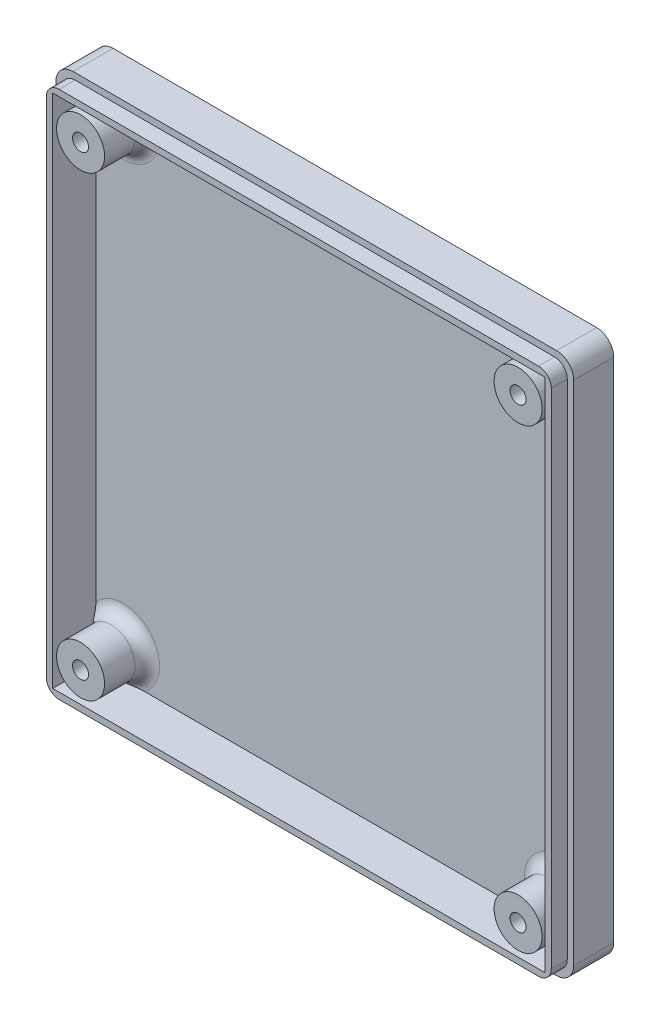
from build123d import *

# Parameters (mm, degrees)
EXTRUDE_THIN1_OUTLINE_W     = 97
EXTRUDE_THIN1_OUTLINE_H     = 101.4
EXTRUDE_THIN1_DEPTH         = 2.4
EXTRUDE_THIN1_START         = 8.1
EXTRUDE_THIN1_2_OUTLINE_W   = 97
EXTRUDE_THIN1_2_OUTLINE_H   = 101.4
EXTRUDE_THIN1_2_DEPTH       = 2.4
EXTRUDE_THIN1_START_2       = 2.4
EXTRUDE_THIN1_3_OUTLINE_W   = 97
EXTRUDE_THIN1_3_OUTLINE_H   = 101.4
EXTRUDE_THIN1_3_OUTLINE_W_2 = 92.2
EXTRUDE_THIN1_3_OUTLINE_H_2 = 96.6
EXTRUDE_THIN1_3_DEPTH       = 5.7
SKETCH4_W                   = 92.2
SKETCH4_H                   = 96.6
CUT_EXTRUDE2_DEPTH          = 2.4
SKETCH5_R                   = 4.5
BOSS_EXTRUDE1_DEPTH         = 8
SKETCH7_R                   = 1.5
CUT_EXTRUDE3_DEPTH          = 13.4
SKETCH10_R                  = 3
CUT_EXTRUDE4_DEPTH          = 3
SKETCH11_R                  = 3
CUT_EXTRUDE5_DEPTH          = 0.8
SKETCH12_W                  = 97
SKETCH12_H                  = 101.4
SKETCH12_W_2                = 94.6
SKETCH12_H_2                = 99
CUT_EXTRUDE_THIN2_DEPTH     = 3
FILLET2_R                   = 3.2
FILLET3_R                   = 2.4
FILLET4_R                   = 2.3


# Read off the part's stored shape, not the designer's step: Extrude-Thin1
with BuildPart() as part:
    # Extrude-Thin1 outline → Extrude-Thin1 (new body)
    with BuildSketch(Plane.XY):
        Rectangle(EXTRUDE_THIN1_OUTLINE_W, EXTRUDE_THIN1_OUTLINE_H)
    extrude(amount=EXTRUDE_THIN1_DEPTH)



with BuildPart() as body_2:
    # Extrude-Thin1 2 outline → Extrude-Thin1 2 (new body)
    with BuildSketch(Plane.XY.offset(EXTRUDE_THIN1_START)):
        Rectangle(EXTRUDE_THIN1_2_OUTLINE_W, EXTRUDE_THIN1_2_OUTLINE_H)
    extrude(amount=EXTRUDE_THIN1_2_DEPTH)


with BuildPart() as part_1:
    add(part.part)

    add(body_2.part)  # Extrude-Thin1 3 merges body 2
    # Extrude-Thin1 3 outline → Extrude-Thin1 3 (add)
    with BuildSketch(Plane.XY.offset(EXTRUDE_THIN1_START_2)):
        Rectangle(EXTRUDE_THIN1_3_OUTLINE_W, EXTRUDE_THIN1_3_OUTLINE_H)
        Rectangle(EXTRUDE_THIN1_3_OUTLINE_W_2, EXTRUDE_THIN1_3_OUTLINE_H_2, mode=Mode.SUBTRACT)
    extrude(amount=EXTRUDE_THIN1_3_DEPTH)

    # Sketch4 → Cut-Extrude2 (cut)
    with BuildSketch(Plane.XY.offset(10.5)):
        Rectangle(SKETCH4_W, SKETCH4_H)
    extrude(amount=-CUT_EXTRUDE2_DEPTH, mode=Mode.SUBTRACT)

    # Sketch5 → Boss-Extrude1 (add)
    with BuildSketch(Plane.XY.offset(2.4)):
        with Locations((-40.98, 42.8)):
            Circle(SKETCH5_R)
        with Locations((40.98, 42.8)):
            Circle(SKETCH5_R)
        with Locations((40.98, -42.8)):
            Circle(SKETCH5_R)
        with Locations((-40.98, -42.8)):
            Circle(SKETCH5_R)
    extrude(amount=BOSS_EXTRUDE1_DEPTH)

    # Sketch7 → Cut-Extrude3 (cut)
    with BuildSketch(Plane.XY.offset(10.4)):
        with Locations((-40.98, 42.8)):
            Circle(SKETCH7_R)
        with Locations((40.98, 42.8)):
            Circle(SKETCH7_R)
        with Locations((40.98, -42.8)):
            Circle(SKETCH7_R)
        with Locations((-40.98, -42.8)):
            Circle(SKETCH7_R)
    extrude(amount=-CUT_EXTRUDE3_DEPTH, mode=Mode.SUBTRACT)

    # Sketch10 → Cut-Extrude4 (cut)
    with BuildSketch(Plane(origin=(0, 0, 0), x_dir=(-1, 0, 0), z_dir=(0, 0, -1))):
        with Locations((-40.98, 42.8)):
            Circle(SKETCH10_R)
        with Locations((40.98, 42.8)):
            Circle(SKETCH10_R)
        with Locations((40.98, -42.8)):
            Circle(SKETCH10_R)
        with Locations((-40.98, -42.8)):
            Circle(SKETCH10_R)
    extrude(amount=-CUT_EXTRUDE4_DEPTH, mode=Mode.SUBTRACT)

    # Sketch11 → Cut-Extrude5 (cut)
    with BuildSketch(Plane(origin=(0, 0, 0), x_dir=(-1, 0, 0), z_dir=(0, 0, -1))):
        with Locations((-40.98, -35.8)):
            Circle(SKETCH11_R)
        with Locations((40.98, -35.8)):
            Circle(SKETCH11_R)
        with Locations((40.98, 35.8)):
            Circle(SKETCH11_R)
        with Locations((-40.98, 35.8)):
            Circle(SKETCH11_R)
    extrude(amount=-CUT_EXTRUDE5_DEPTH, mode=Mode.SUBTRACT)

    # Sketch12 → Cut-Extrude-Thin2 (cut)
    with BuildSketch(Plane.XY.offset(10.5)):
        Rectangle(SKETCH12_W, SKETCH12_H)
        Rectangle(SKETCH12_W_2, SKETCH12_H_2, mode=Mode.SUBTRACT)
    extrude(amount=-CUT_EXTRUDE_THIN2_DEPTH, mode=Mode.SUBTRACT)

    # Fillet2
    fillet2_edges = [part_1.edges().sort_by_distance(p)[0] for p in [
        (48.5, -50.7, 3.75),
        (-48.5, -50.7, 3.75),
        (-48.5, 50.7, 3.75),
        (48.5, 50.7, 3.75),
    ]]
    fillet(fillet2_edges, radius=FILLET2_R)

    # Fillet3
    fillet3_edges = [part_1.edges().sort_by_distance(p)[0] for p in [
        (-47.3, 49.5, 9),
        (47.3, 49.5, 9),
        (47.3, -49.5, 9),
        (-47.3, -49.5, 9),
    ]]
    fillet(fillet3_edges, radius=FILLET3_R)

    # Fillet4
    # the kernel refuses this fillet: 2.3 mm, written as the material it adds along each edge
    with BuildSketch(Plane(origin=(-40.98, 42.8, 2.4), x_dir=(1, 0, 0), z_dir=(0, -1, 0))) as fillet4_piece_1:
        with BuildLine():
            CenterArc((4.5 + FILLET4_R, FILLET4_R), FILLET4_R, 180, 90)
            Line((4.5, FILLET4_R), (4.5, 0))
            Line((4.5, 0), (4.5 + FILLET4_R, 0))
        make_face()
    revolve(axis=Axis((-40.98, 42.8, 2.4), (0, 0, 1)))
    with BuildSketch(Plane(origin=(40.98, 42.8, 2.4), x_dir=(1, 0, 0), z_dir=(0, -1, 0))) as fillet4_piece_2:
        with BuildLine():
            CenterArc((4.5 + FILLET4_R, FILLET4_R), FILLET4_R, 180, 90)
            Line((4.5, FILLET4_R), (4.5, 0))
            Line((4.5, 0), (4.5 + FILLET4_R, 0))
        make_face()
    revolve(axis=Axis((40.98, 42.8, 2.4), (0, 0, 1)))
    with BuildSketch(Plane(origin=(40.98, -42.8, 2.4), x_dir=(1, 0, 0), z_dir=(0, -1, 0))) as fillet4_piece_3:
        with BuildLine():
            CenterArc((4.5 + FILLET4_R, FILLET4_R), FILLET4_R, 180, 90)
            Line((4.5, FILLET4_R), (4.5, 0))
            Line((4.5, 0), (4.5 + FILLET4_R, 0))
        make_face()
    revolve(axis=Axis((40.98, -42.8, 2.4), (0, 0, 1)))
    with BuildSketch(Plane(origin=(-40.98, -42.8, 2.4), x_dir=(1, 0, 0), z_dir=(0, -1, 0))) as fillet4_piece_4:
        with BuildLine():
            CenterArc((4.5 + FILLET4_R, FILLET4_R), FILLET4_R, 180, 90)
            Line((4.5, FILLET4_R), (4.5, 0))
            Line((4.5, 0), (4.5 + FILLET4_R, 0))
        make_face()
    revolve(axis=Axis((-40.98, -42.8, 2.4), (0, 0, 1)))


solid = part_1.part
